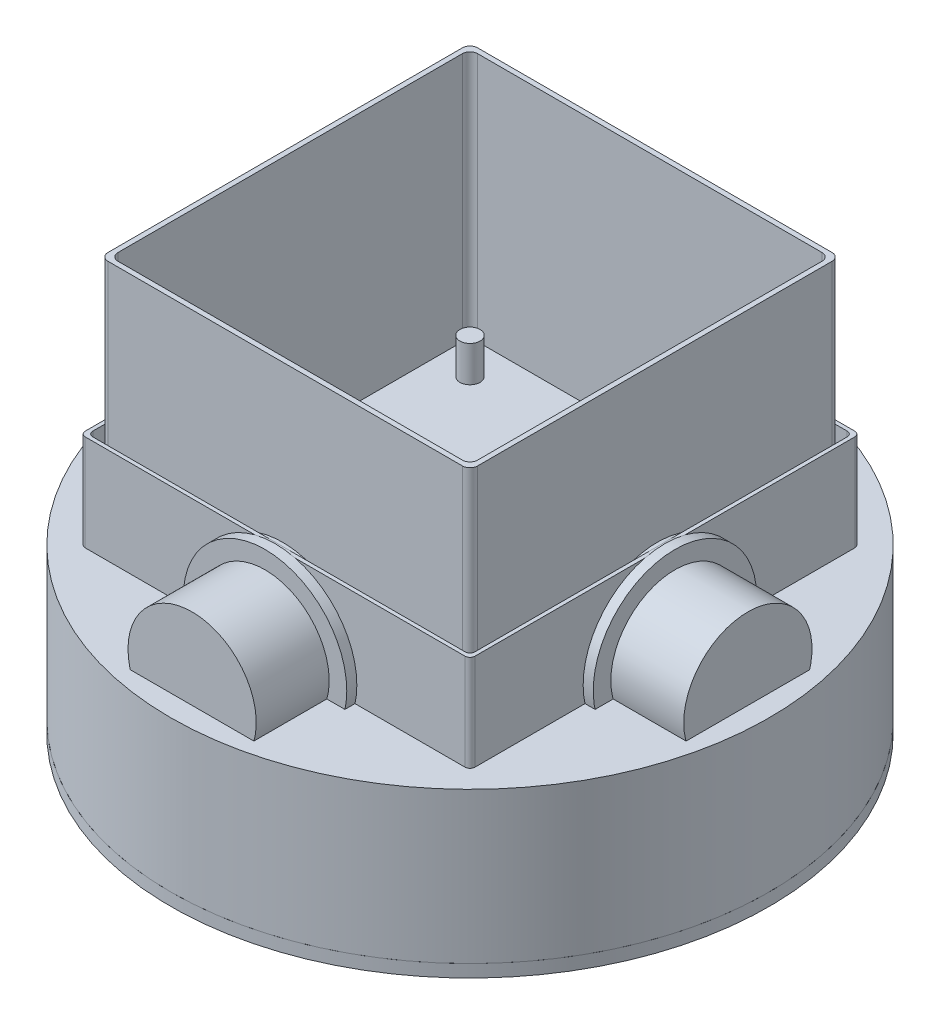
from build123d import *
from OCP.BRepFilletAPI import BRepFilletAPI_MakeChamfer
from build123d.topology import SkipClean

# Parameters (mm, degrees)
SKETCH_1_W           = 103
SKETCH_1_H           = 3.03
SKETCH_1637_W        = 8.2
SKETCH_1637_H        = 8.2
EXTRUDE_1825_DEPTH   = 2
EXTRUDE_1825_2_DEPTH = 2
EXTRUDE_1825_3_DEPTH = 2
EXTRUDE_1825_4_DEPTH = 2
SKETCH_2_W           = 124
SKETCH_2_H           = 124
SKETCH_2_W_2         = 50
SKETCH_2_H_2         = 56
EXTRUDE_2_DEPTH      = 0.5
SKETCH_1_2_R         = 4
EXTRUDE_1_DEPTH      = 15.5
EXTRUDE_1_2_DEPTH    = 15.5
EXTRUDE_1_3_DEPTH    = 15.5
EXTRUDE_1_4_DEPTH    = 15.5
SKETCH_1_3_W         = 124
SKETCH_1_3_H         = 124
SKETCH_1_3_W_2       = 88
SKETCH_1_3_H_2       = 88
SKETCH_1_3_W_3       = 30.24
SKETCH_1_3_H_3       = 2
EXTRUDE_1_5_DEPTH    = 0.5
SKETCH_2_2_R         = 4
EXTRUDE_2_2_DEPTH    = 15.5
EXTRUDE_2_2_2_DEPTH  = 15.5
EXTRUDE_2_2_3_DEPTH  = 15.5
EXTRUDE_2_2_4_DEPTH  = 15.5
SKETCH_2_3_W         = 124
SKETCH_2_3_H         = 124
SKETCH_2_3_W_2       = 88
SKETCH_2_3_H_2       = 88
SKETCH_2_3_W_3       = 30.24
SKETCH_2_3_H_3       = 2
EXTRUDE_2_3_DEPTH    = 0.5
SKETCH_3_R           = 4
EXTRUDE_3_DEPTH      = 15.5
EXTRUDE_3_2_DEPTH    = 15.5
EXTRUDE_3_3_DEPTH    = 15.5
EXTRUDE_3_4_DEPTH    = 15.5
SKETCH_1_4_W         = 50
SKETCH_1_4_H         = 56
EXTRUDE_1_6_DEPTH    = 0.5
SKETCH_4_R           = 4
EXTRUDE_4_DEPTH      = 15.5
EXTRUDE_4_2_DEPTH    = 15.5
EXTRUDE_4_3_DEPTH    = 15.5
EXTRUDE_4_4_DEPTH    = 15.5
SKETCH_R1_W          = 2
SKETCH_R1_H          = 12.5
EXTRUDE_R1_DEPTH     = 7
EXTRUDE_R1_2_DEPTH   = 7
EXTRUDE_R1_3_DEPTH   = 7
EXTRUDE_R1_4_DEPTH   = 7
SKETCH_R2_W          = 12.5
SKETCH_R2_H          = 2
EXTRUDE_R2_DEPTH     = 7
EXTRUDE_R2_2_DEPTH   = 7
EXTRUDE_R2_3_DEPTH   = 7
EXTRUDE_R2_4_DEPTH   = 7
EXTRUDE_R2_5_DEPTH   = 7
EXTRUDE_R2_6_DEPTH   = 7
SKETCH_R3_W          = 2
SKETCH_R3_H          = 12.5
EXTRUDE_R3_DEPTH     = 7
EXTRUDE_R3_2_DEPTH   = 7
EXTRUDE_R3_3_DEPTH   = 7
EXTRUDE_R3_4_DEPTH   = 7
EXTRUDE_R3_5_DEPTH   = 7
SKETCH_R4_W          = 2
SKETCH_R4_H          = 12.5
EXTRUDE_R4_DEPTH     = 7
EXTRUDE_R4_2_DEPTH   = 7
EXTRUDE_R4_3_DEPTH   = 7
EXTRUDE_6621_DEPTH   = 150
EXTRUDE_6931_DEPTH   = 63
CUT_EXTRUDE_1_REACH  = 284.391
SKETCH_1_5_R         = 25.5
CUT_EXTRUDE_2_REACH  = 284.391
SKETCH_2_4_R         = 25.5
SKETCH_1_6_R         = 31.5
SKETCH_1_6_R_2       = 25.5
EXTRUDE_1_7_DEPTH    = 2.48
SKETCH_2_5_R         = 31.5
SKETCH_2_5_R_2       = 25.5
EXTRUDE_2_4_DEPTH    = 2.48
SKETCH_3_2_R         = 31.5
SKETCH_3_2_R_2       = 25.5
EXTRUDE_3_5_DEPTH    = 2.48
SKETCH_4_2_R         = 31.5
SKETCH_4_2_R_2       = 25.5
EXTRUDE_4_5_DEPTH    = 2.48
CHAMFER_7926_SIZE    = 1
CHAMFER_7926_SIZE2   = 1.732050808
SKETCH_1_1_R         = 32.5
EXTRUDE_1_1_DEPTH    = 4
SKETCH_1_2_2_R       = 32.5
EXTRUDE_1_2_2_DEPTH  = 4
SKETCH_1_3_2_R       = 32.5
EXTRUDE_1_3_2_DEPTH  = 4
SKETCH_1_4_2_R       = 32.5
EXTRUDE_1_4_2_DEPTH  = 4
SKETCH_2_1_R         = 25.5
EXTRUDE_2_1_DEPTH    = 29
SKETCH_2_2_2_R       = 25.5
EXTRUDE_2_2_5_DEPTH  = 29
SKETCH_2_3_2_R       = 25.5
EXTRUDE_2_3_2_DEPTH  = 29
SKETCH_2_4_2_R       = 25.5
EXTRUDE_2_4_2_DEPTH  = 29
SKETCH_8858_R        = 119
EXTRUDE_8910_DEPTH   = 60


with BuildPart() as part:
    # Sketch 1 → Revolve 1278 (revolve)
    with BuildSketch(Plane.XY, mode=Mode.PRIVATE) as revolve_1278_sk:
        Polygon((0, 0), (0, 10), (103, 10), (107, 5), (119, 5), (119, 0), align=None)
        with Locations((51.5, 11.515)):
            Rectangle(SKETCH_1_W, SKETCH_1_H)
        Polygon((0, 10), (0, 0), (119, 0), (119, 5), (107, 5), (103, 10), align=None)
    revolve(revolve_1278_sk.sketch.rotate(Axis((0, 0, 0), (0, 1, 0)), 90), axis=Axis((0, 0, 0), (0, 1, 0)))


with BuildPart() as body_2:
    # Sketch 1637 → Extrude 1825 (new body)
    with BuildSketch(Plane(origin=(0, 13.23, 0), x_dir=(1, 0, 0), z_dir=(0, 1, 0))):
        with Locations((58, 58)):
            Rectangle(SKETCH_1637_W, SKETCH_1637_H)
    extrude(amount=EXTRUDE_1825_DEPTH)


with BuildPart() as body_3:
    # Sketch 1637 → Extrude 1825 2 (new body)
    with BuildSketch(Plane(origin=(0, 13.23, 0), x_dir=(1, 0, 0), z_dir=(0, 1, 0))):
        with Locations((-58, 58)):
            Rectangle(SKETCH_1637_W, SKETCH_1637_H)
    extrude(amount=EXTRUDE_1825_2_DEPTH)


with BuildPart() as body_4:
    # Sketch 1637 → Extrude 1825 3 (new body)
    with BuildSketch(Plane(origin=(0, 13.23, 0), x_dir=(1, 0, 0), z_dir=(0, 1, 0))):
        with Locations((58, -58)):
            Rectangle(SKETCH_1637_W, SKETCH_1637_H)
    extrude(amount=EXTRUDE_1825_3_DEPTH)


with BuildPart() as body_5:
    # Sketch 1637 → Extrude 1825 4 (new body)
    with BuildSketch(Plane(origin=(0, 13.23, 0), x_dir=(1, 0, 0), z_dir=(0, 1, 0))):
        with Locations((-58, -58)):
            Rectangle(SKETCH_1637_W, SKETCH_1637_H)
    extrude(amount=EXTRUDE_1825_4_DEPTH)


with BuildPart() as body_6:
    # Sketch 2 → Extrude 2 (new body)
    with BuildSketch(Plane(origin=(0, 15.23, 0), x_dir=(1, 0, 0), z_dir=(0, 1, 0))):
        Rectangle(SKETCH_2_W, SKETCH_2_H)
        with Locations((3, 14)):
            Rectangle(SKETCH_2_W_2, SKETCH_2_H_2, mode=Mode.SUBTRACT)
    extrude(amount=EXTRUDE_2_DEPTH)


with BuildPart() as body_7:
    # Sketch 1 2 → Extrude 1 (new body)
    with BuildSketch(Plane(origin=(0, 15.73, 0), x_dir=(1, 0, 0), z_dir=(0, 1, 0))):
        with Locations(Location((-58, 58, 0), (0, 0, 270))):
            Circle(SKETCH_1_2_R)
    extrude(amount=EXTRUDE_1_DEPTH)


with BuildPart() as body_8:
    # Sketch 1 2 → Extrude 1 2 (new body)
    with BuildSketch(Plane(origin=(0, 15.73, 0), x_dir=(1, 0, 0), z_dir=(0, 1, 0))):
        with Locations(Location((58, 58, 0), (0, 0, 270))):
            Circle(SKETCH_1_2_R)
    extrude(amount=EXTRUDE_1_2_DEPTH)


with BuildPart() as body_9:
    # Sketch 1 2 → Extrude 1 3 (new body)
    with BuildSketch(Plane(origin=(0, 15.73, 0), x_dir=(1, 0, 0), z_dir=(0, 1, 0))):
        with Locations(Location((58, -58, 0), (0, 0, 270))):
            Circle(SKETCH_1_2_R)
    extrude(amount=EXTRUDE_1_3_DEPTH)


with BuildPart() as body_10:
    # Sketch 1 2 → Extrude 1 4 (new body)
    with BuildSketch(Plane(origin=(0, 15.73, 0), x_dir=(1, 0, 0), z_dir=(0, 1, 0))):
        with Locations(Location((-58, -58, 0), (0, 0, 270))):
            Circle(SKETCH_1_2_R)
    extrude(amount=EXTRUDE_1_4_DEPTH)


with BuildPart() as body_11:
    # Sketch 1 3 → Extrude 1 5 (new body)
    with BuildSketch(Plane(origin=(0, 31.23, 0), x_dir=(1, 0, 0), z_dir=(0, 1, 0))):
        Rectangle(SKETCH_1_3_W, SKETCH_1_3_H)
        Rectangle(SKETCH_1_3_W_2, SKETCH_1_3_H_2, mode=Mode.SUBTRACT)
        with Locations((-26.361890484, 48.403156918)):
            Rectangle(SKETCH_1_3_W_3, SKETCH_1_3_H_3, mode=Mode.SUBTRACT)
    extrude(amount=EXTRUDE_1_5_DEPTH)


with BuildPart() as body_12:
    # Sketch 2 2 → Extrude 2 2 (new body)
    with BuildSketch(Plane(origin=(0, 31.73, 0), x_dir=(1, 0, 0), z_dir=(0, 1, 0))):
        with Locations(Location((-58, 58, 0), (0, 0, 270))):
            Circle(SKETCH_2_2_R)
    extrude(amount=EXTRUDE_2_2_DEPTH)


with BuildPart() as body_13:
    # Sketch 2 2 → Extrude 2 2 2 (new body)
    with BuildSketch(Plane(origin=(0, 31.73, 0), x_dir=(1, 0, 0), z_dir=(0, 1, 0))):
        with Locations(Location((58, 58, 0), (0, 0, 270))):
            Circle(SKETCH_2_2_R)
    extrude(amount=EXTRUDE_2_2_2_DEPTH)


with BuildPart() as body_14:
    # Sketch 2 2 → Extrude 2 2 3 (new body)
    with BuildSketch(Plane(origin=(0, 31.73, 0), x_dir=(1, 0, 0), z_dir=(0, 1, 0))):
        with Locations(Location((58, -58, 0), (0, 0, 270))):
            Circle(SKETCH_2_2_R)
    extrude(amount=EXTRUDE_2_2_3_DEPTH)


with BuildPart() as body_15:
    # Sketch 2 2 → Extrude 2 2 4 (new body)
    with BuildSketch(Plane(origin=(0, 31.73, 0), x_dir=(1, 0, 0), z_dir=(0, 1, 0))):
        with Locations(Location((-58, -58, 0), (0, 0, 270))):
            Circle(SKETCH_2_2_R)
    extrude(amount=EXTRUDE_2_2_4_DEPTH)


with BuildPart() as body_16:
    # Sketch 2 3 → Extrude 2 3 (new body)
    with BuildSketch(Plane(origin=(0, 47.23, 0), x_dir=(1, 0, 0), z_dir=(0, 1, 0))):
        Rectangle(SKETCH_2_3_W, SKETCH_2_3_H)
        Rectangle(SKETCH_2_3_W_2, SKETCH_2_3_H_2, mode=Mode.SUBTRACT)
        with Locations((-26.316026444, 48.253353038)):
            Rectangle(SKETCH_2_3_W_3, SKETCH_2_3_H_3, mode=Mode.SUBTRACT)
    extrude(amount=EXTRUDE_2_3_DEPTH)


with BuildPart() as body_17:
    # Sketch 3 → Extrude 3 (new body)
    with BuildSketch(Plane(origin=(0, 47.73, 0), x_dir=(1, 0, 0), z_dir=(0, 1, 0))):
        with Locations(Location((-58, 58, 0), (0, 0, 270))):
            Circle(SKETCH_3_R)
    extrude(amount=EXTRUDE_3_DEPTH)


with BuildPart() as body_18:
    # Sketch 3 → Extrude 3 2 (new body)
    with BuildSketch(Plane(origin=(0, 47.73, 0), x_dir=(1, 0, 0), z_dir=(0, 1, 0))):
        with Locations(Location((58, 58, 0), (0, 0, 270))):
            Circle(SKETCH_3_R)
    extrude(amount=EXTRUDE_3_2_DEPTH)


with BuildPart() as body_19:
    # Sketch 3 → Extrude 3 3 (new body)
    with BuildSketch(Plane(origin=(0, 47.73, 0), x_dir=(1, 0, 0), z_dir=(0, 1, 0))):
        with Locations(Location((58, -58, 0), (0, 0, 270))):
            Circle(SKETCH_3_R)
    extrude(amount=EXTRUDE_3_3_DEPTH)


with BuildPart() as body_20:
    # Sketch 3 → Extrude 3 4 (new body)
    with BuildSketch(Plane(origin=(0, 47.73, 0), x_dir=(1, 0, 0), z_dir=(0, 1, 0))):
        with Locations(Location((-58, -58, 0), (0, 0, 270))):
            Circle(SKETCH_3_R)
    extrude(amount=EXTRUDE_3_4_DEPTH)


with BuildPart() as body_21:
    # Sketch 1 4 → Extrude 1 6 (new body)
    with BuildSketch(Plane(origin=(0, 63.23, 0), x_dir=(1, 0, 0), z_dir=(0, 1, 0))):
        Polygon((51, 67), (40, 67), (37, 62), (29, 62), (29, 67), (18, 67), (18, 62), (-62, 62), (-62, -62), (62, -62), (62, 62), (51, 62), align=None)
        with Locations((4, 4)):
            Rectangle(SKETCH_1_4_W, SKETCH_1_4_H, mode=Mode.SUBTRACT)
    extrude(amount=EXTRUDE_1_6_DEPTH)


with BuildPart() as body_22:
    # Sketch 4 → Extrude 4 (new body)
    with BuildSketch(Plane(origin=(0, 63.73, 0), x_dir=(1, 0, 0), z_dir=(0, 1, 0))):
        with Locations(Location((-58, 58, 0), (0, 0, 270))):
            Circle(SKETCH_4_R)
    extrude(amount=EXTRUDE_4_DEPTH)


with BuildPart() as body_23:
    # Sketch 4 → Extrude 4 2 (new body)
    with BuildSketch(Plane(origin=(0, 63.73, 0), x_dir=(1, 0, 0), z_dir=(0, 1, 0))):
        with Locations(Location((58, 58, 0), (0, 0, 270))):
            Circle(SKETCH_4_R)
    extrude(amount=EXTRUDE_4_2_DEPTH)


with BuildPart() as body_24:
    # Sketch 4 → Extrude 4 3 (new body)
    with BuildSketch(Plane(origin=(0, 63.73, 0), x_dir=(1, 0, 0), z_dir=(0, 1, 0))):
        with Locations(Location((58, -58, 0), (0, 0, 270))):
            Circle(SKETCH_4_R)
    extrude(amount=EXTRUDE_4_3_DEPTH)


with BuildPart() as body_25:
    # Sketch 4 → Extrude 4 4 (new body)
    with BuildSketch(Plane(origin=(0, 63.73, 0), x_dir=(1, 0, 0), z_dir=(0, 1, 0))):
        with Locations(Location((-58, -58, 0), (0, 0, 270))):
            Circle(SKETCH_4_R)
    extrude(amount=EXTRUDE_4_4_DEPTH)


with BuildPart() as body_26:
    # Эски R1 → R1 (new body)
    with BuildSketch(Plane(origin=(0, 50.73, 0), x_dir=(1, 0, 0), z_dir=(0, 1, 0))):
        with Locations((63.477542008, 14.605022786)):
            Rectangle(SKETCH_R1_W, SKETCH_R1_H)
    extrude(amount=EXTRUDE_R1_DEPTH)


with BuildPart() as body_27:
    # Эски R1 → Extrude R1 2 (new body)
    with BuildSketch(Plane(origin=(0, 50.73, 0), x_dir=(1, 0, 0), z_dir=(0, 1, 0))):
        with Locations((63.477542008, 28.431468896)):
            Rectangle(SKETCH_R1_W, SKETCH_R1_H)
    extrude(amount=EXTRUDE_R1_2_DEPTH)


with BuildPart() as body_28:
    # Эски R1 → Extrude R1 3 (new body)
    with BuildSketch(Plane(origin=(0, 50.73, 0), x_dir=(1, 0, 0), z_dir=(0, 1, 0))):
        with Locations((63.126259064, -30.795548782)):
            Rectangle(SKETCH_R1_W, SKETCH_R1_H)
    extrude(amount=EXTRUDE_R1_3_DEPTH)


with BuildPart() as body_29:
    # Эски R1 → Extrude R1 4 (new body)
    with BuildSketch(Plane(origin=(0, 50.73, 0), x_dir=(1, 0, 0), z_dir=(0, 1, 0))):
        with Locations((65.261343105, -30.806447067)):
            Rectangle(SKETCH_R1_W, SKETCH_R1_H)
    extrude(amount=EXTRUDE_R1_4_DEPTH)


with BuildPart() as body_30:
    # Sketch R2 → R2 (new body)
    with BuildSketch(Plane(origin=(-1.914746908, 36.728327048, 0), x_dir=(0.9986438544142355, 0.052062001888893795, 0), z_dir=(0.0520620018888938, -0.9986438544142356, 0))):
        with Locations((-25.487551089, 63.179102149)):
            Rectangle(SKETCH_R2_W, SKETCH_R2_H)
    extrude(amount=-EXTRUDE_R2_DEPTH)


with BuildPart() as body_31:
    # Sketch R2 → Extrude R2 2 (new body)
    with BuildSketch(Plane(origin=(-1.914746908, 36.728327048, 0), x_dir=(0.9986438544142355, 0.052062001888893795, 0), z_dir=(0.0520620018888938, -0.9986438544142356, 0))):
        with Locations((-40.987551089, 63.179102149)):
            Rectangle(SKETCH_R2_W, SKETCH_R2_H)
    extrude(amount=-EXTRUDE_R2_2_DEPTH)


with BuildPart() as body_32:
    # Sketch R2 → Extrude R2 3 (new body)
    with BuildSketch(Plane(origin=(-1.914746908, 36.728327048, 0), x_dir=(0.9986438544142355, 0.052062001888893795, 0), z_dir=(0.0520620018888938, -0.9986438544142356, 0))):
        with Locations((-9.987551089, 63.179102149)):
            Rectangle(SKETCH_R2_W, SKETCH_R2_H)
    extrude(amount=-EXTRUDE_R2_3_DEPTH)


with BuildPart() as body_33:
    # Sketch R2 → Extrude R2 4 (new body)
    with BuildSketch(Plane(origin=(-1.914746908, 36.728327048, 0), x_dir=(0.9986438544142355, 0.052062001888893795, 0), z_dir=(0.0520620018888938, -0.9986438544142356, 0))):
        with Locations((5.512448911, 63.179102149)):
            Rectangle(SKETCH_R2_W, SKETCH_R2_H)
    extrude(amount=-EXTRUDE_R2_4_DEPTH)


with BuildPart() as body_34:
    # Sketch R2 → Extrude R2 5 (new body)
    with BuildSketch(Plane(origin=(-1.914746908, 36.728327048, 0), x_dir=(0.9986438544142355, 0.052062001888893795, 0), z_dir=(0.0520620018888938, -0.9986438544142356, 0))):
        with Locations((21.012448911, 63.179102149)):
            Rectangle(SKETCH_R2_W, SKETCH_R2_H)
    extrude(amount=-EXTRUDE_R2_5_DEPTH)


with BuildPart() as body_35:
    # Sketch R2 → Extrude R2 6 (new body)
    with BuildSketch(Plane(origin=(-1.914746908, 36.728327048, 0), x_dir=(0.9986438544142355, 0.052062001888893795, 0), z_dir=(0.0520620018888938, -0.9986438544142356, 0))):
        with Locations((36.512448911, 63.179102149)):
            Rectangle(SKETCH_R2_W, SKETCH_R2_H)
    extrude(amount=-EXTRUDE_R2_6_DEPTH)


with BuildPart() as body_36:
    # Эскиз R3 → R3 (new body)
    with BuildSketch(Plane(origin=(0, 32.73, 0), x_dir=(1, 0, 0), z_dir=(0, 1, 0))):
        with Locations((63.477542008, 28.431468896)):
            Rectangle(SKETCH_R3_W, SKETCH_R3_H)
    extrude(amount=EXTRUDE_R3_DEPTH)


with BuildPart() as body_37:
    # Эскиз R3 → Extrude R3 2 (new body)
    with BuildSketch(Plane(origin=(0, 32.73, 0), x_dir=(1, 0, 0), z_dir=(0, 1, 0))):
        with Locations((63.477542008, 14.605022786)):
            Rectangle(SKETCH_R3_W, SKETCH_R3_H)
    extrude(amount=EXTRUDE_R3_2_DEPTH)


with BuildPart() as body_38:
    # Эскиз R3 → Extrude R3 3 (new body)
    with BuildSketch(Plane(origin=(0, 32.73, 0), x_dir=(1, 0, 0), z_dir=(0, 1, 0))):
        with Locations((63.126259064, -30.795548782)):
            Rectangle(SKETCH_R3_W, SKETCH_R3_H)
    extrude(amount=EXTRUDE_R3_3_DEPTH)


with BuildPart() as body_39:
    # Эскиз R3 → Extrude R3 4 (new body)
    with BuildSketch(Plane(origin=(0, 32.73, 0), x_dir=(1, 0, 0), z_dir=(0, 1, 0))):
        with Locations((65.261343105, -30.806447067)):
            Rectangle(SKETCH_R3_W, SKETCH_R3_H)
    extrude(amount=EXTRUDE_R3_4_DEPTH)


with BuildPart() as body_40:
    # Эскиз R3 → Extrude R3 5 (new body)
    with BuildSketch(Plane(origin=(0, 32.73, 0), x_dir=(1, 0, 0), z_dir=(0, 1, 0))):
        with Locations((67.383740862, -30.803729228)):
            Rectangle(SKETCH_R3_W, SKETCH_R3_H)
    extrude(amount=EXTRUDE_R3_5_DEPTH)


with BuildPart() as body_41:
    # Эскиз R4 → R4 (new body)
    with BuildSketch(Plane(origin=(0, 16.73, 0), x_dir=(1, 0, 0), z_dir=(0, 1, 0))):
        with Locations((63.303700514, 27.760855487)):
            Rectangle(SKETCH_R4_W, SKETCH_R4_H)
    extrude(amount=EXTRUDE_R4_DEPTH)


with BuildPart() as body_42:
    # Эскиз R4 → Extrude R4 2 (new body)
    with BuildSketch(Plane(origin=(0, 16.73, 0), x_dir=(1, 0, 0), z_dir=(0, 1, 0))):
        with Locations((63.28973747, 42.144871245)):
            Rectangle(SKETCH_R4_W, SKETCH_R4_H)
    extrude(amount=EXTRUDE_R4_2_DEPTH)


with BuildPart() as body_43:
    # Эскиз R4 → Extrude R4 3 (new body)
    with BuildSketch(Plane(origin=(0, 16.73, 0), x_dir=(1, 0, 0), z_dir=(0, 1, 0))):
        with Locations((63.308197719, 12.686041693)):
            Rectangle(SKETCH_R4_W, SKETCH_R4_H)
    extrude(amount=EXTRUDE_R4_3_DEPTH)


with BuildPart() as body_44:
    # Sketch 6337 → Extrude 6621 (new body)
    with BuildSketch(Plane(origin=(0, 14.23, 0), x_dir=(1, 0, 0), z_dir=(0, 1, 0))):
        with BuildLine():
            Line((-70.5, 73.5), (70.5, 73.5))
            ThreePointArc((70.5, 73.5), (72.621320344, 72.621320344), (73.5, 70.5))
            Line((73.5, 70.5), (73.5, -70.5))
            ThreePointArc((73.5, -70.5), (72.621320344, -72.621320344), (70.5, -73.5))
            Line((70.5, -73.5), (-70.5, -73.5))
            ThreePointArc((-70.5, -73.5), (-72.621320344, -72.621320344), (-73.5, -70.5))
            Line((-73.5, -70.5), (-73.5, 70.5))
            ThreePointArc((-73.5, 70.5), (-72.621320344, 72.621320344), (-70.5, 73.5))
        make_face()
        with BuildLine():
            Line((-68.5, 71.5), (68.5, 71.5))
            ThreePointArc((68.5, 71.5), (70.621320344, 70.621320344), (71.5, 68.5))
            Line((71.5, 68.5), (71.5, -68.5))
            ThreePointArc((71.5, -68.5), (70.621320344, -70.621320344), (68.5, -71.5))
            Line((68.5, -71.5), (-68.5, -71.5))
            ThreePointArc((-68.5, -71.5), (-70.621320344, -70.621320344), (-71.5, -68.5))
            Line((-71.5, -68.5), (-71.5, 68.5))
            ThreePointArc((-71.5, 68.5), (-70.621320344, 70.621320344), (-68.5, 71.5))
        make_face(mode=Mode.SUBTRACT)
    extrude(amount=EXTRUDE_6621_DEPTH)


with BuildPart() as body_45:
    # Sketch 6687 → Extrude 6931 (new body)
    with BuildSketch(Plane(origin=(0, 40.23, 0), x_dir=(-1, 0, 0), z_dir=(0, -1, 0))):
        with BuildLine():
            Line((75.5, -77.5), (-75.5, -77.5))
            ThreePointArc((-75.5, -77.5), (-76.914213562, -76.914213562), (-77.5, -75.5))
            Line((-77.5, -75.5), (-77.5, 75.5))
            ThreePointArc((-77.5, 75.5), (-76.914213562, 76.914213562), (-75.5, 77.5))
            Line((-75.5, 77.5), (75.5, 77.5))
            ThreePointArc((75.5, 77.5), (76.914213562, 76.914213562), (77.5, 75.5))
            Line((77.5, 75.5), (77.5, -75.5))
            ThreePointArc((77.5, -75.5), (76.914213562, -76.914213562), (75.5, -77.5))
        make_face()
        with BuildLine():
            Line((74, 76), (-74, 76))
            ThreePointArc((-74, 76), (-75.414213562, 75.414213562), (-76, 74))
            Line((-76, 74), (-76, -74))
            ThreePointArc((-76, -74), (-75.414213562, -75.414213562), (-74, -76))
            Line((-74, -76), (74, -76))
            ThreePointArc((74, -76), (75.414213562, -75.414213562), (76, -74))
            Line((76, -74), (76, 74))
            ThreePointArc((76, 74), (75.414213562, 75.414213562), (74, 76))
        make_face(mode=Mode.SUBTRACT)
    extrude(amount=-EXTRUDE_6931_DEPTH)

    # Вырез-1: up to this face of the body (flat: up to its plane)
    cut_extrude_1_end = Plane(body_45.part.faces().sort_by_distance((0, 71.73, -77.5))[0])
    # Sketch 1 5 → Вырез-1 (cut, up to the picked face)
    with BuildSketch(Plane.XY.offset(77.5), mode=Mode.PRIVATE) as cut_extrude_1_sk1:
        with Locations(Location((0, 71.73, 0), (0, 0, 180))):
            Circle(SKETCH_1_5_R)
    cut_extrude_1_tool1 = split(extrude(cut_extrude_1_sk1.sketch, amount=-CUT_EXTRUDE_1_REACH, mode=Mode.PRIVATE), bisect_by=cut_extrude_1_end, keep=Keep.BOTH, mode=Mode.PRIVATE)
    add(cut_extrude_1_tool1.solids().sort_by(Axis((0, 71.73, 77.5), (0, 0, -1)))[0], mode=Mode.SUBTRACT)

    # Вырез-2: up to this face of the body (flat: up to its plane)
    cut_extrude_2_end = Plane(body_45.part.faces().sort_by_distance((-77.5, 71.73, 0))[0])
    # Sketch 2 4 → Вырез-2 (cut, up to the picked face)
    with BuildSketch(Plane(origin=(77.5, 0, 0), x_dir=(0, 0, -1), z_dir=(1, 0, 0)), mode=Mode.PRIVATE) as cut_extrude_2_sk1:
        with Locations(Location((0, 71.73, 0), (0, 0, 180))):
            Circle(SKETCH_2_4_R)
    cut_extrude_2_tool1 = split(extrude(cut_extrude_2_sk1.sketch, amount=-CUT_EXTRUDE_2_REACH, mode=Mode.PRIVATE), bisect_by=cut_extrude_2_end, keep=Keep.BOTH, mode=Mode.PRIVATE)
    add(cut_extrude_2_tool1.solids().sort_by(Axis((77.5, 71.73, 0), (-1, 0, 0)))[0], mode=Mode.SUBTRACT)

    # Sketch 1 6 → Extrude 1 7 (add)
    with SkipClean():  # the faces are left unmerged after this step: merging them gives an invalid solid
        with BuildSketch(Plane(origin=(0, 0, 76), x_dir=(-1, 0, 0), z_dir=(0, 0, -1))):
            with Locations(Location((0, 71.73, 0), (0, 0, 270))):
                Circle(SKETCH_1_6_R)
            with Locations((0, 71.73)):
                Circle(SKETCH_1_6_R_2, mode=Mode.SUBTRACT)
        extrude(amount=EXTRUDE_1_7_DEPTH)

    # Sketch 2 5 → Extrude 2 4 (add)
    with SkipClean():  # the faces are left unmerged after this step: merging them gives an invalid solid
        with BuildSketch(Plane.ZY.offset(-76)):
            with Locations(Location((0, 71.73, 0), (0, 0, 270))):
                Circle(SKETCH_2_5_R)
            with Locations((0, 71.73)):
                Circle(SKETCH_2_5_R_2, mode=Mode.SUBTRACT)
        extrude(amount=EXTRUDE_2_4_DEPTH)

    # Sketch 3 2 → Extrude 3 5 (add)
    with SkipClean():  # the faces are left unmerged after this step: merging them gives an invalid solid
        with BuildSketch(Plane.XY.offset(-76)):
            with Locations(Location((0, 71.73, 0), (0, 0, 270))):
                Circle(SKETCH_3_2_R)
            with Locations((0, 71.73)):
                Circle(SKETCH_3_2_R_2, mode=Mode.SUBTRACT)
        extrude(amount=EXTRUDE_3_5_DEPTH)
    add(body_45.part.scale(1), mode=Mode.REPLACE)  # the faces are merged on a copy

    # Sketch 4 2 → Extrude 4 5 (add)
    with SkipClean():  # the faces are left unmerged after this step: merging them gives an invalid solid
        with BuildSketch(Plane(origin=(-76, 0, 0), x_dir=(0, 0, -1), z_dir=(1, 0, 0))):
            with Locations(Location((0, 71.73, 0), (0, 0, 270))):
                Circle(SKETCH_4_2_R)
            with Locations((0, 71.73)):
                Circle(SKETCH_4_2_R_2, mode=Mode.SUBTRACT)
        extrude(amount=EXTRUDE_4_5_DEPTH)
    add(body_45.part.scale(1), mode=Mode.REPLACE)  # the faces are merged on a copy

    # Chamfer 7926: one chamfer whose edges measure the first distance from different faces: ONE call of the kernel's chamfer builder (chamfer() names one face for all edges)
    chamfer_7926_edges_1 = [body_45.edges().sort_by_distance(p)[0] for p in [
        (0, 103.23, 73.52),
    ]]
    chamfer_7926_side_1 = [body_45.faces().sort_by_distance(p)[0] for p in [
        (0, 103.23, 74.76),
    ]]
    chamfer_7926_edges_2 = [body_45.edges().sort_by_distance(p)[0] for p in [
        (73.52, 103.23, 0),
    ]]
    chamfer_7926_side_2 = [body_45.faces().sort_by_distance(p)[0] for p in [
        (74.76, 103.23, 0),
    ]]
    chamfer_7926_edges_3 = [body_45.edges().sort_by_distance(p)[0] for p in [
        (0, 103.23, -73.52),
    ]]
    chamfer_7926_side_3 = [body_45.faces().sort_by_distance(p)[0] for p in [
        (0, 103.23, -74.76),
    ]]
    chamfer_7926_edges_4 = [body_45.edges().sort_by_distance(p)[0] for p in [
        (-73.52, 103.23, 0),
    ]]
    chamfer_7926_side_4 = [body_45.faces().sort_by_distance(p)[0] for p in [
        (-74.76, 103.23, 0),
    ]]
    chamfer_7926 = BRepFilletAPI_MakeChamfer(body_45.part.solid().wrapped)
    for e in chamfer_7926_edges_1:
        chamfer_7926.Add(CHAMFER_7926_SIZE, CHAMFER_7926_SIZE2, e.wrapped, chamfer_7926_side_1[0].wrapped)  # the first distance lies on this face
    for e in chamfer_7926_edges_2:
        chamfer_7926.Add(CHAMFER_7926_SIZE, CHAMFER_7926_SIZE2, e.wrapped, chamfer_7926_side_2[0].wrapped)  # the first distance lies on this face
    for e in chamfer_7926_edges_3:
        chamfer_7926.Add(CHAMFER_7926_SIZE, CHAMFER_7926_SIZE2, e.wrapped, chamfer_7926_side_3[0].wrapped)  # the first distance lies on this face
    for e in chamfer_7926_edges_4:
        chamfer_7926.Add(CHAMFER_7926_SIZE, CHAMFER_7926_SIZE2, e.wrapped, chamfer_7926_side_4[0].wrapped)  # the first distance lies on this face
    add(Compound.cast(chamfer_7926.Shape()), mode=Mode.REPLACE)

    # Эскиз ФЭУ_1_1 → Бобышка-ФЭУ_1_1 (add)
    with SkipClean():  # the faces are left unmerged after this step: merging them gives an invalid solid
        with BuildSketch(Plane.XY.offset(77.5)):
            with Locations(Location((0, 71.73, 0), (0, 0, 104.250032698))):
                Circle(SKETCH_1_1_R)
        extrude(amount=EXTRUDE_1_1_DEPTH)

    # Sketch 1_2 2 → Extrude 1_2 2 (add)
    with SkipClean():  # the faces are left unmerged after this step: merging them gives an invalid solid
        with BuildSketch(Plane(origin=(77.5, 0, 0), x_dir=(0, 0, -1), z_dir=(1, 0, 0))):
            with Locations(Location((0, 71.73, 0), (0, 0, 104.250032698))):
                Circle(SKETCH_1_2_2_R)
        extrude(amount=EXTRUDE_1_2_2_DEPTH)

    # Sketch 1_3 2 → Extrude 1_3 2 (add)
    with SkipClean():  # the faces are left unmerged after this step: merging them gives an invalid solid
        with BuildSketch(Plane(origin=(0, 0, -77.5), x_dir=(-1, 0, 0), z_dir=(0, 0, -1))):
            with Locations(Location((0, 71.73, 0), (0, 0, 75.749967302))):
                Circle(SKETCH_1_3_2_R)
        extrude(amount=EXTRUDE_1_3_2_DEPTH)

    # Sketch 1_4 2 → Extrude 1_4 2 (add)
    with SkipClean():  # the faces are left unmerged after this step: merging them gives an invalid solid
        with BuildSketch(Plane.ZY.offset(77.5)):
            with Locations(Location((0, 71.73, 0), (0, 0, 75.749967302))):
                Circle(SKETCH_1_4_2_R)
        extrude(amount=EXTRUDE_1_4_2_DEPTH)

    # Эскиз-ФЭУ_2_1 → Бобышка-ФЭУ_2_1 (add)
    with SkipClean():  # the faces are left unmerged after this step: merging them gives an invalid solid
        with BuildSketch(Plane.XY.offset(81.5)):
            with Locations((0, 71.73)):
                Circle(SKETCH_2_1_R)
        extrude(amount=EXTRUDE_2_1_DEPTH)

    # Sketch 2_2 2 → Extrude 2_2 5 (add)
    with SkipClean():  # the faces are left unmerged after this step: merging them gives an invalid solid
        with BuildSketch(Plane(origin=(81.5, 0, 0), x_dir=(0, 0, -1), z_dir=(1, 0, 0))):
            with Locations((0, 71.73)):
                Circle(SKETCH_2_2_2_R)
        extrude(amount=EXTRUDE_2_2_5_DEPTH)

    # Sketch 2_3 2 → Extrude 2_3 2 (add)
    with SkipClean():  # the faces are left unmerged after this step: merging them gives an invalid solid
        with BuildSketch(Plane(origin=(0, 0, -81.5), x_dir=(-1, 0, 0), z_dir=(0, 0, -1))):
            with Locations(Location((0, 71.73, 0), (0, 0, 180))):
                Circle(SKETCH_2_3_2_R)
        extrude(amount=EXTRUDE_2_3_2_DEPTH)

    # Sketch 2_4 2 → Extrude 2_4 2 (add)
    with SkipClean():  # the faces are left unmerged after this step: merging them gives an invalid solid
        with BuildSketch(Plane.ZY.offset(81.5)):
            with Locations(Location((0, 71.73, 0), (0, 0, 180))):
                Circle(SKETCH_2_4_2_R)
        extrude(amount=EXTRUDE_2_4_2_DEPTH)


with BuildPart() as body_46:
    # Sketch 8858 → Extrude 8910 (new body)
    with BuildSketch(Plane(origin=(0, 5, 0), x_dir=(1, 0, 0), z_dir=(0, 1, 0))):
        with Locations(Location((0, 0, 0), (0, 0, 270))):
            Circle(SKETCH_8858_R)
    extrude(amount=EXTRUDE_8910_DEPTH)


solid = Compound([part.part, body_2.part, body_3.part, body_4.part, body_5.part, body_6.part, body_7.part, body_8.part, body_9.part, body_10.part, body_11.part, body_12.part, body_13.part, body_14.part, body_15.part, body_16.part, body_17.part, body_18.part, body_19.part, body_20.part, body_21.part, body_22.part, body_23.part, body_24.part, body_25.part, body_26.part, body_27.part, body_28.part, body_29.part, body_30.part, body_31.part, body_32.part, body_33.part, body_34.part, body_35.part, body_36.part, body_37.part, body_38.part, body_39.part, body_40.part, body_41.part, body_42.part, body_43.part, body_44.part, body_45.part, body_46.part])
